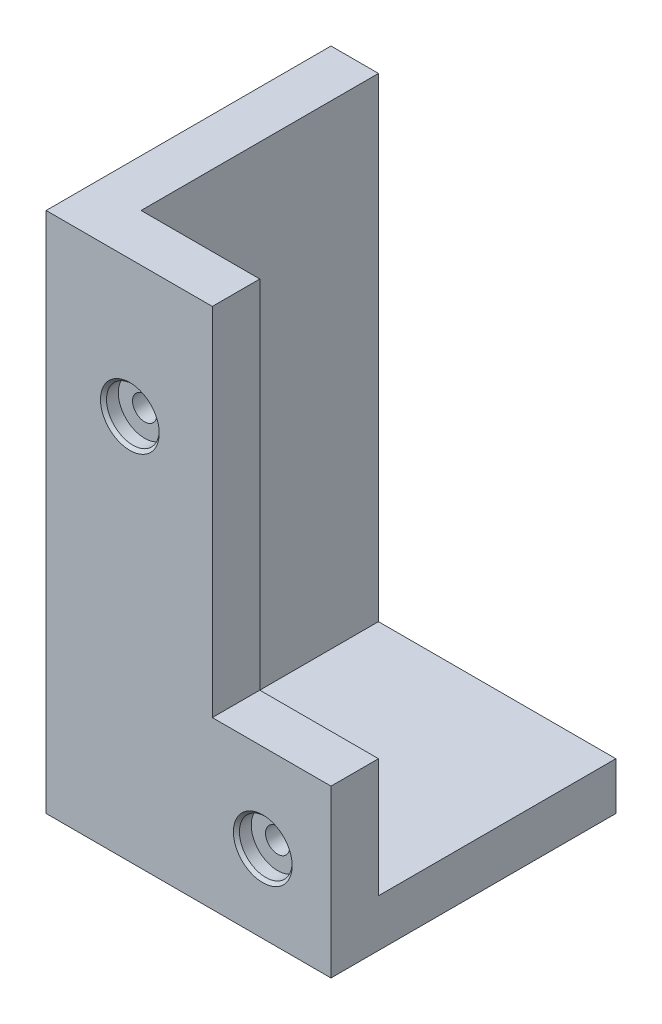
from build123d import *

# Parameters (mm, degrees)
BOSS_EXTRUDE1_DEPTH                           = 50
BOSS_EXTRUDE2_DEPTH                           = 10
CBORE_FOR_10_BINDING_HEAD_MACHINE_S_2_COUNT   = 2
CBORE_FOR_10_BINDING_HEAD_MACHINE_S_2_PITCH   = 70.641523205
CBORE_FOR_10_BINDING_HEAD_MACHINE_S_3_A_COUNT = 2
CBORE_FOR_10_BINDING_HEAD_MACHINE_S_3_A_PITCH = 49.556001394


with BuildPart() as part:
    # Sketch1 → Boss-Extrude1 (new body)
    with BuildSketch(Plane.XY):
        Polygon((0, 110), (10, 110), (10, 10), (60, 10), (60, 0), (0, 0), align=None)
    extrude(amount=BOSS_EXTRUDE1_DEPTH)

    # Sketch2 → Boss-Extrude2 (add)
    with BuildSketch(Plane.XY.offset(50)):
        Polygon((0, 110), (35, 110), (35, 35), (60, 35), (60, 0), (0, 0), align=None)
    extrude(amount=BOSS_EXTRUDE2_DEPTH)

    # Sketch3 → CBORE for _10 Binding Head Machine Screw (revolve, cut)
    with BuildSketch(Plane(origin=(17.635166565, 81.246186772, 60), x_dir=(0, -1, 0), z_dir=(1, 0, 0))):
        Polygon((0, 0), (0, 60.000025), (2.5527, 60.000025), (2.5527, 3.1242), (5.55625, 3.1242), (5.55625, 0.635), (6.19125, 0), align=None)
    cbore_for_10_binding_head_machine_screw = revolve(axis=Axis((17.635166565, 81.246186772, 66.35), (0, 0, -1)), mode=Mode.SUBTRACT)

    # CBORE for _10 Binding Head Machine S 2: CBORE for _10 Binding Head Machine Screw ×2
    with Locations(*[Vector(0.396309487955917, -0.9181169804312079, 0) * (i * CBORE_FOR_10_BINDING_HEAD_MACHINE_S_2_PITCH) for i in range(1, CBORE_FOR_10_BINDING_HEAD_MACHINE_S_2_COUNT)]):
        add(cbore_for_10_binding_head_machine_screw, mode=Mode.SUBTRACT)

    # Sketch5 → CBORE for _10 Binding Head Machine S 3 (revolve, cut)
    with BuildSketch(Plane(origin=(0, 80.128657782, 29.532478053), x_dir=(0, 0, 1), z_dir=(0, 1, 0))):
        Polygon((0, 0), (0, 60.00005), (2.5527, 60.00005), (2.5527, 3.1242), (5.55625, 3.1242), (5.55625, 0.635), (6.19125, 0), align=None)
    cbore_for_10_binding_head_machine_s_3 = revolve(axis=Axis((-6.35, 80.128657782, 29.532478053), (1, 0, 0)), mode=Mode.SUBTRACT)

    # CBORE for _10 Binding Head Machine S 3 a: CBORE for _10 Binding Head Machine S 3 ×2
    with Locations(*[(0, -i * CBORE_FOR_10_BINDING_HEAD_MACHINE_S_3_A_PITCH, 0) for i in range(1, CBORE_FOR_10_BINDING_HEAD_MACHINE_S_3_A_COUNT)]):
        add(cbore_for_10_binding_head_machine_s_3, mode=Mode.SUBTRACT)

    # Sketch7 → CBORE for _10 Binding Head Machine S 4 (revolve, cut)
    with BuildSketch(Plane(origin=(30.127527572, 0, 29.936236214), x_dir=(0, 0, -1), z_dir=(1, 0, 0))):
        Polygon((0, 0), (0, 110.00005), (2.5527, 110.00005), (2.5527, 3.1242), (5.55625, 3.1242), (5.55625, 0.635), (6.19125, 0), align=None)
    revolve(axis=Axis((30.127527572, -6.35, 29.936236214), (0, 1, 0)), mode=Mode.SUBTRACT)


solid = part.part
